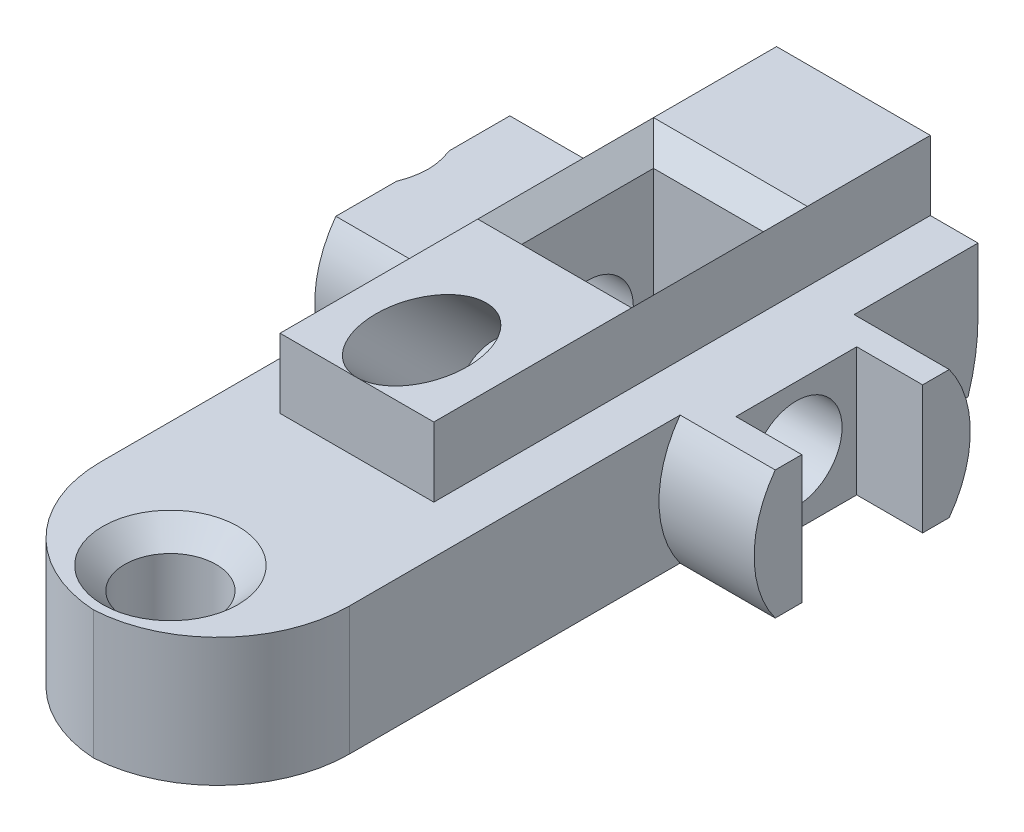
from build123d import *

# Parameters (mm, degrees)
BOSS_EXTRUDE1_DEPTH      = 20
SKETCH3_W                = 11.34
SKETCH3_H                = 5.84
BOSS_EXTRUDE2_DEPTH      = 25
FILLET1_R                = 6
SKETCH4_W                = 7
SKETCH4_H                = 8
BOSS_EXTRUDE3_DEPTH      = 9
BOSS_EXTRUDE4_DEPTH      = 13
BOSS_EXTRUDE4_DEPTH_BACK = 9.6
SKETCH5_W                = 5
SKETCH5_H                = 6
CUT_EXTRUDE1_DEPTH       = 9
SKETCH6_R                = 2.0825
CUT_EXTRUDE2_DEPTH       = 5.84
CUT_EXTRUDE3_REACH       = 34.581
SKETCH8_R                = 2.0825
SKETCH9_W                = 3
SKETCH9_H                = 5.5
CUT_EXTRUDE4_DEPTH       = 5.84
CUT_EXTRUDE5_DEPTH       = 11.34
SKETCH13_R               = 2.0825
CUT_EXTRUDE7_DEPTH       = 8


with BuildPart() as part:
    # Sketch2 → Boss-Extrude1 (new body)
    with BuildSketch(Plane(origin=(0, 0, 0), x_dir=(0, 0, -1), z_dir=(1, 0, 0))):
        with BuildLine():
            ThreePointArc((3.959797975, 2.92), (4.92, 0), (3.959797975, -2.92))
            Line((3.959797975, -2.92), (-3.959797975, -2.92))
            ThreePointArc((-3.959797975, -2.92), (-4.92, 0), (-3.959797975, 2.92))
            Line((-3.959797975, 2.92), (3.959797975, 2.92))
        make_face()
    extrude(amount=BOSS_EXTRUDE1_DEPTH)

    # Sketch3 → Boss-Extrude2 (add)
    with BuildSketch(Plane.XY):
        with Locations((10, 0)):
            Rectangle(SKETCH3_W, SKETCH3_H)
    extrude(amount=BOSS_EXTRUDE2_DEPTH)

    # Fillet1
    # the kernel refuses this fillet: 6 mm, written as the material it takes off along each edge
    with BuildSketch(Plane(origin=(15.67, -17.92, 25), x_dir=(0, 0, -1), z_dir=(0, 1, 0)), Plane(origin=(4.33, 17.92, 25), x_dir=(0, 0, -1), z_dir=(0, -1, 0))) as fillet1_piece_1:
        with BuildLine():
            CenterArc((FILLET1_R, FILLET1_R), FILLET1_R, 180, 90)
            Line((0, FILLET1_R), (0, 0))
            Line((0, 0), (FILLET1_R, 0))
        make_face()
    extrude(amount=35.84, mode=Mode.SUBTRACT)

    # Sketch4 → Boss-Extrude3 (add)
    with BuildSketch(Plane.XZ.offset(2.92)):
        with Locations((10, 0.040202025)):
            Rectangle(SKETCH4_W, SKETCH4_H)
    extrude(amount=-BOSS_EXTRUDE3_DEPTH)

    # Sketch10 → Boss-Extrude4 (add, two sides: drawn at the far end of the back side and taken through both)
    with BuildSketch(Plane.XY.offset(-BOSS_EXTRUDE4_DEPTH_BACK)):
        Polygon((10, -2.92), (15.67, -2.92), (15.67, 2.92), (13.5, 2.92), (13.5, 6.08), (6.5, 6.08), (6.5, 2.92), (4.33, 2.92), (4.33, -2.92), align=None)
    extrude(amount=BOSS_EXTRUDE4_DEPTH + BOSS_EXTRUDE4_DEPTH_BACK)

    # Sketch5 → Cut-Extrude1 (cut)
    with BuildSketch(Plane(origin=(0, 6.08, 0), x_dir=(1, 0, 0), z_dir=(0, 1, 0))):
        with Locations((10, 0)):
            Rectangle(SKETCH5_W, SKETCH5_H)
    extrude(amount=-CUT_EXTRUDE1_DEPTH, mode=Mode.SUBTRACT)

    # Sketch6 → Cut-Extrude2 (cut)
    with BuildSketch(Plane(origin=(0, 2.92, 0), x_dir=(1, 0, 0), z_dir=(0, 1, 0))):
        with Locations(Location((10, -21.490918127, 0), (0, 0, 270))):
            Circle(SKETCH6_R)
    extrude(amount=-CUT_EXTRUDE2_DEPTH, mode=Mode.SUBTRACT)

    # Cut-Extrude3: up to this face of the body (flat: up to its plane)
    cut_extrude3_end = Plane(part.part.faces().sort_by_distance((0, 0, 0))[0])
    # Sketch8 → Cut-Extrude3 (cut, up to the picked face)
    with BuildSketch(Plane(origin=(20, 0, 0), x_dir=(0, 0, -1), z_dir=(1, 0, 0)), mode=Mode.PRIVATE) as cut_extrude3_sk1:
        with Locations((0, 0.08)):
            Circle(SKETCH8_R)
    cut_extrude3_tool1 = split(extrude(cut_extrude3_sk1.sketch, amount=-CUT_EXTRUDE3_REACH, mode=Mode.PRIVATE), bisect_by=cut_extrude3_end, keep=Keep.BOTH, mode=Mode.PRIVATE)
    add(cut_extrude3_tool1.solids().sort_by(Axis((20, 0.08, 0), (-1, 0, 0)))[0], mode=Mode.SUBTRACT)

    # Sketch9 → Cut-Extrude4 (cut)
    with BuildSketch(Plane(origin=(0, 2.92, 0), x_dir=(1, 0, 0), z_dir=(0, 1, 0))):
        with Locations((18.5, 0)):
            Rectangle(SKETCH9_W, SKETCH9_H)
    extrude(amount=-CUT_EXTRUDE4_DEPTH, mode=Mode.SUBTRACT)

    # Chamfer1
    # the kernel refuses this chamfer: 1 mm, written as the material it takes off along each edge
    with BuildSketch(Plane(origin=(12.5, 6.08, 3), x_dir=(0.9996219169112968, 0.027495876610587375, 0), z_dir=(0, 0, -1)), Plane(origin=(7.5, 6.08, -3), x_dir=(-0.9996219169112968, 0.02749587661058735, 0), z_dir=(0, 0, 1))) as chamfer1_piece_1:
        with BuildLine():
            Line((1.028673195, 0), (-0.056547155, 1.027117794))
            Line((-0.056547155, 1.027117794), (-0.076539593, 1.026567876))
            ThreePointArc((-0.076539593, 1.026567876), (-0.034129227, 0.51339783), (-0.019992438, -0.000549918))
            Line((-0.019992438, -0.000549918), (0.000549918, -0.019992438))
            ThreePointArc((0.000549918, -0.019992438), (0.514497665, -0.00585565), (1.029223113, -0.019992438))
            Line((1.029223113, -0.019992438), (1.028673195, 0))
        make_face()
    extrude(amount=6, mode=Mode.SUBTRACT)
    with BuildSketch(Plane(origin=(12.5, 6.08, -3), x_dir=(0, 0.02749587661058736, -0.9996219169112968), z_dir=(-1, 0, 0)), Plane(origin=(7.5, 6.08, 3), x_dir=(0, 0.02749587661058736, 0.9996219169112968), z_dir=(1, 0, 0))) as chamfer1_piece_2:
        with BuildLine():
            Line((1.028673195, 0), (-0.056547155, 1.027117794))
            Line((-0.056547155, 1.027117794), (-0.076539593, 1.026567876))
            ThreePointArc((-0.076539593, 1.026567876), (-0.034129227, 0.51339783), (-0.019992438, -0.000549918))
            Line((-0.019992438, -0.000549918), (0.000549918, -0.019992438))
            ThreePointArc((0.000549918, -0.019992438), (0.514497665, -0.00585565), (1.029223113, -0.019992438))
            Line((1.029223113, -0.019992438), (1.028673195, 0))
        make_face()
    extrude(amount=5, mode=Mode.SUBTRACT)
    with BuildSketch(Plane(origin=(10, 2.92, 21.490918127), x_dir=(0, 0, 1), z_dir=(-1, 0, 0))) as chamfer1_piece_3:
        with BuildLine():
            Line((3.110784271, 0.028284271), (2.054215729, -1.028284271))
            Line((2.054215729, -1.028284271), (2.034215729, -1.028284271))
            ThreePointArc((2.034215729, -1.028284271), (2.0625, -0.514142136), (2.0625, 0))
            Line((2.0625, 0), (2.0825, 0.02))
            ThreePointArc((2.0825, 0.02), (2.596642136, 0.02), (3.110784271, 0.048284271))
            Line((3.110784271, 0.048284271), (3.110784271, 0.028284271))
        make_face()
    revolve(axis=Axis((10, 2.92, 21.490918127), (0, 1, 0)), mode=Mode.SUBTRACT)
    with BuildSketch(Plane(origin=(0, 0.08, 0), x_dir=(0, 0, -1), z_dir=(0, -1, 0))) as chamfer1_piece_4:
        with BuildLine():
            Line((3.110784271, -0.028284271), (2.054215729, 1.028284271))
            Line((2.054215729, 1.028284271), (2.034215729, 1.028284271))
            ThreePointArc((2.034215729, 1.028284271), (2.0625, 0.514142136), (2.0625, 0))
            Line((2.0625, 0), (2.0825, -0.02))
            ThreePointArc((2.0825, -0.02), (2.596642136, -0.02), (3.110784271, -0.048284271))
            Line((3.110784271, -0.048284271), (3.110784271, -0.028284271))
        make_face()
    revolve(axis=Axis((0, 0.08, 0), (1, 0, 0)), mode=Mode.SUBTRACT)
    with BuildSketch(Plane(origin=(12.5, 6.08, 5.571682988), x_dir=(0.9996219169112968, 0.02749587661058651, 0), z_dir=(0, 0, -1))) as chamfer1_piece_5a_section:
        with BuildLine():
            Line((1.028673195, 0), (-0.056547155, 1.027117794))
            Line((-0.056547155, 1.027117794), (-0.076539593, 1.026567876))
            ThreePointArc((-0.076539593, 1.026567876), (-0.034129227, 0.51339783), (-0.019992438, -0.000549918))
            Line((-0.019992438, -0.000549918), (0.000549918, -0.019992438))
            ThreePointArc((0.000549918, -0.019992438), (0.514497665, -0.00585565), (1.029223113, -0.019992438))
            Line((1.029223113, -0.019992438), (1.028673195, 0))
        make_face()
    chamfer1_piece_5a = extrude(amount=8.571682988, mode=Mode.PRIVATE)
    chamfer1_piece_5a = split(chamfer1_piece_5a, bisect_by=Plane(origin=(12.829793627, 5.750206373, 3), z_dir=(0, 0, 1)), keep=Keep.TOP, mode=Mode.PRIVATE)
    with BuildSketch(Plane(origin=(7.5, 6.08, 3), x_dir=(0, 0.02749587661058736, 0.9996219169112968), z_dir=(1, 0, 0))) as chamfer1_piece_5b_section:
        with BuildLine():
            Line((1.028673195, 0), (-0.056547155, 1.027117794))
            Line((-0.056547155, 1.027117794), (-0.076539593, 1.026567876))
            ThreePointArc((-0.076539593, 1.026567876), (-0.034129227, 0.51339783), (-0.019992438, -0.000549918))
            Line((-0.019992438, -0.000549918), (0.000549918, -0.019992438))
            ThreePointArc((0.000549918, -0.019992438), (0.514497665, -0.00585565), (1.029223113, -0.019992438))
            Line((1.029223113, -0.019992438), (1.028673195, 0))
        make_face()
    chamfer1_piece_5b = extrude(amount=7.571682988, mode=Mode.PRIVATE)
    chamfer1_piece_5b = split(chamfer1_piece_5b, bisect_by=Plane(origin=(12.5, 5.750206373, 3.329793627), z_dir=(1, 0, 0)), keep=Keep.TOP, mode=Mode.PRIVATE)
    chamfer1_piece_5 = chamfer1_piece_5a & chamfer1_piece_5b
    add(chamfer1_piece_5, mode=Mode.SUBTRACT)
    with BuildSketch(Plane(origin=(15.071682988, 6.08, -3), x_dir=(0, 0.027495876610586497, -0.9996219169112968), z_dir=(-1, 0, 0))) as chamfer1_piece_6a_section:
        with BuildLine():
            Line((1.028673195, 0), (-0.056547155, 1.027117794))
            Line((-0.056547155, 1.027117794), (-0.076539593, 1.026567876))
            ThreePointArc((-0.076539593, 1.026567876), (-0.034129227, 0.51339783), (-0.019992438, -0.000549918))
            Line((-0.019992438, -0.000549918), (0.000549918, -0.019992438))
            ThreePointArc((0.000549918, -0.019992438), (0.514497665, -0.00585565), (1.029223113, -0.019992438))
            Line((1.029223113, -0.019992438), (1.028673195, 0))
        make_face()
    chamfer1_piece_6a = extrude(amount=7.571682988, mode=Mode.PRIVATE)
    chamfer1_piece_6a = split(chamfer1_piece_6a, bisect_by=Plane(origin=(12.5, 5.750206373, -3.329793627), z_dir=(1, 0, 0)), keep=Keep.TOP, mode=Mode.PRIVATE)
    with BuildSketch(Plane(origin=(12.5, 6.08, 3), x_dir=(0.9996219169112968, 0.027495876610587375, 0), z_dir=(0, 0, -1))) as chamfer1_piece_6b_section:
        with BuildLine():
            Line((1.028673195, 0), (-0.056547155, 1.027117794))
            Line((-0.056547155, 1.027117794), (-0.076539593, 1.026567876))
            ThreePointArc((-0.076539593, 1.026567876), (-0.034129227, 0.51339783), (-0.019992438, -0.000549918))
            Line((-0.019992438, -0.000549918), (0.000549918, -0.019992438))
            ThreePointArc((0.000549918, -0.019992438), (0.514497665, -0.00585565), (1.029223113, -0.019992438))
            Line((1.029223113, -0.019992438), (1.028673195, 0))
        make_face()
    chamfer1_piece_6b = extrude(amount=8.571682988, mode=Mode.PRIVATE)
    chamfer1_piece_6b = split(chamfer1_piece_6b, bisect_by=Plane(origin=(12.829793627, 5.750206373, -3), z_dir=(0, 0, -1)), keep=Keep.TOP, mode=Mode.PRIVATE)
    chamfer1_piece_6 = chamfer1_piece_6a & chamfer1_piece_6b
    add(chamfer1_piece_6, mode=Mode.SUBTRACT)
    with BuildSketch(Plane(origin=(7.5, 6.08, -5.571682988), x_dir=(-0.9996219169112968, 0.027495876610586487, 0), z_dir=(0, 0, 1))) as chamfer1_piece_7a_section:
        with BuildLine():
            Line((1.028673195, 0), (-0.056547155, 1.027117794))
            Line((-0.056547155, 1.027117794), (-0.076539593, 1.026567876))
            ThreePointArc((-0.076539593, 1.026567876), (-0.034129227, 0.51339783), (-0.019992438, -0.000549918))
            Line((-0.019992438, -0.000549918), (0.000549918, -0.019992438))
            ThreePointArc((0.000549918, -0.019992438), (0.514497665, -0.00585565), (1.029223113, -0.019992438))
            Line((1.029223113, -0.019992438), (1.028673195, 0))
        make_face()
    chamfer1_piece_7a = extrude(amount=8.571682988, mode=Mode.PRIVATE)
    chamfer1_piece_7a = split(chamfer1_piece_7a, bisect_by=Plane(origin=(7.170206373, 5.750206373, -3), z_dir=(0, 0, -1)), keep=Keep.TOP, mode=Mode.PRIVATE)
    with BuildSketch(Plane(origin=(12.5, 6.08, -3), x_dir=(0, 0.02749587661058736, -0.9996219169112968), z_dir=(-1, 0, 0))) as chamfer1_piece_7b_section:
        with BuildLine():
            Line((1.028673195, 0), (-0.056547155, 1.027117794))
            Line((-0.056547155, 1.027117794), (-0.076539593, 1.026567876))
            ThreePointArc((-0.076539593, 1.026567876), (-0.034129227, 0.51339783), (-0.019992438, -0.000549918))
            Line((-0.019992438, -0.000549918), (0.000549918, -0.019992438))
            ThreePointArc((0.000549918, -0.019992438), (0.514497665, -0.00585565), (1.029223113, -0.019992438))
            Line((1.029223113, -0.019992438), (1.028673195, 0))
        make_face()
    chamfer1_piece_7b = extrude(amount=7.571682988, mode=Mode.PRIVATE)
    chamfer1_piece_7b = split(chamfer1_piece_7b, bisect_by=Plane(origin=(7.5, 5.750206373, -3.329793627), z_dir=(-1, 0, 0)), keep=Keep.TOP, mode=Mode.PRIVATE)
    chamfer1_piece_7 = chamfer1_piece_7a & chamfer1_piece_7b
    add(chamfer1_piece_7, mode=Mode.SUBTRACT)
    with BuildSketch(Plane(origin=(7.5, 6.08, -3), x_dir=(-0.9996219169112968, 0.02749587661058735, 0), z_dir=(0, 0, 1))) as chamfer1_piece_8a_section:
        with BuildLine():
            Line((1.028673195, 0), (-0.056547155, 1.027117794))
            Line((-0.056547155, 1.027117794), (-0.076539593, 1.026567876))
            ThreePointArc((-0.076539593, 1.026567876), (-0.034129227, 0.51339783), (-0.019992438, -0.000549918))
            Line((-0.019992438, -0.000549918), (0.000549918, -0.019992438))
            ThreePointArc((0.000549918, -0.019992438), (0.514497665, -0.00585565), (1.029223113, -0.019992438))
            Line((1.029223113, -0.019992438), (1.028673195, 0))
        make_face()
    chamfer1_piece_8a = extrude(amount=8.571682988, mode=Mode.PRIVATE)
    chamfer1_piece_8a = split(chamfer1_piece_8a, bisect_by=Plane(origin=(7.170206373, 5.750206373, 3), z_dir=(0, 0, 1)), keep=Keep.TOP, mode=Mode.PRIVATE)
    with BuildSketch(Plane(origin=(4.928317012, 6.08, 3), x_dir=(0, 0.027495876610586497, 0.9996219169112968), z_dir=(1, 0, 0))) as chamfer1_piece_8b_section:
        with BuildLine():
            Line((1.028673195, 0), (-0.056547155, 1.027117794))
            Line((-0.056547155, 1.027117794), (-0.076539593, 1.026567876))
            ThreePointArc((-0.076539593, 1.026567876), (-0.034129227, 0.51339783), (-0.019992438, -0.000549918))
            Line((-0.019992438, -0.000549918), (0.000549918, -0.019992438))
            ThreePointArc((0.000549918, -0.019992438), (0.514497665, -0.00585565), (1.029223113, -0.019992438))
            Line((1.029223113, -0.019992438), (1.028673195, 0))
        make_face()
    chamfer1_piece_8b = extrude(amount=7.571682988, mode=Mode.PRIVATE)
    chamfer1_piece_8b = split(chamfer1_piece_8b, bisect_by=Plane(origin=(7.5, 5.750206373, 3.329793627), z_dir=(-1, 0, 0)), keep=Keep.TOP, mode=Mode.PRIVATE)
    chamfer1_piece_8 = chamfer1_piece_8a & chamfer1_piece_8b
    add(chamfer1_piece_8, mode=Mode.SUBTRACT)

    # Sketch11 → Cut-Extrude5 (cut)
    with BuildSketch(Plane.ZY.offset(-4.33)):
        with BuildLine():
            Line((-9.145140786, -2.92), (-9.6, -2.92))
            Line((-9.6, -2.92), (-9.6, 0))
            ThreePointArc((-9.6, 0), (-9.485603606, -1.477607602), (-9.145140786, -2.92))
        make_face()
    extrude(amount=-CUT_EXTRUDE5_DEPTH, mode=Mode.SUBTRACT)

    # Sketch13 → Cut-Extrude7 (cut)
    with BuildSketch(Plane(origin=(0, 9.54, 9.54), x_dir=(-1, 0, 0), z_dir=(0, 0.7071067811865464, 0.7071067811865488))):
        with Locations(Location((-10, 2.810678926, 0), (0, 0, 90))):
            Circle(SKETCH13_R)
    extrude(amount=-CUT_EXTRUDE7_DEPTH, mode=Mode.SUBTRACT)


solid = part.part
